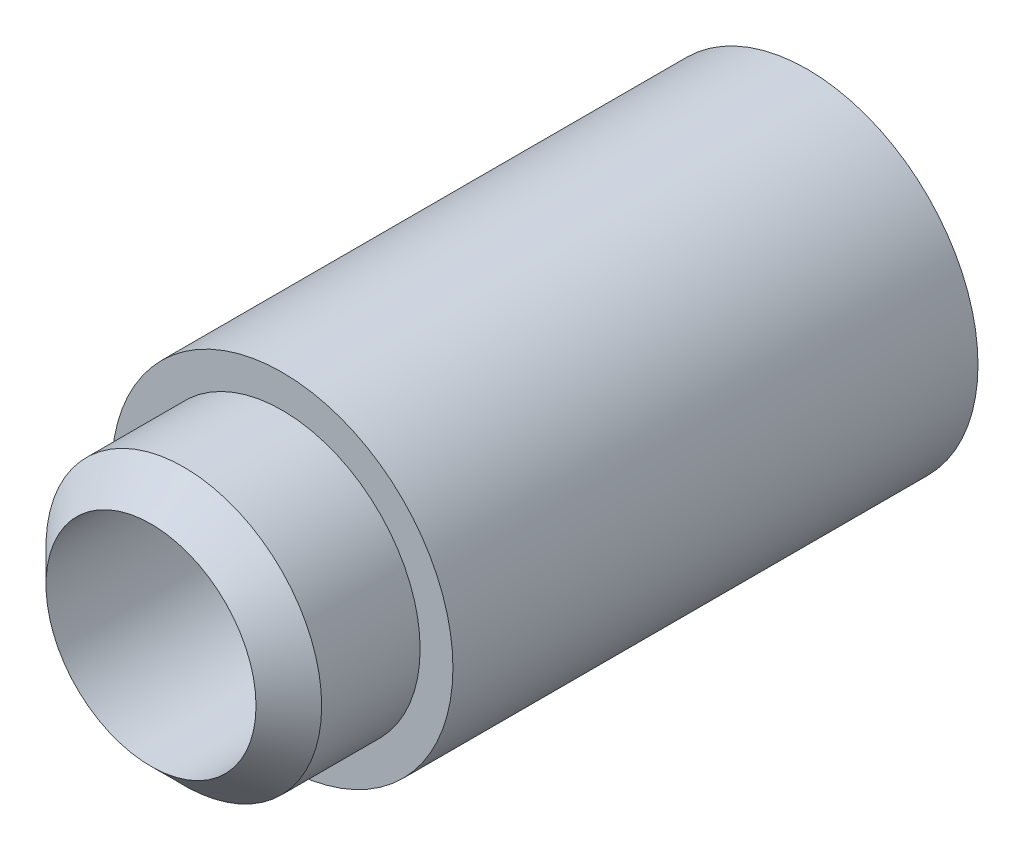
from build123d import *

# Parameters (mm, degrees)
SKETCH15_R          = 26
SKETCH15_R_2        = 21
BOSS_EXTRUDE2_DEPTH = 80
BOSS_EXTRUDE5_START = -10
SKETCH18_R          = 21
SKETCH18_R_2        = 16
BOSS_EXTRUDE5_DEPTH = 30
CHAMFER1_SIZE       = 5


with BuildPart() as part:
    # Sketch15 → Boss-Extrude2 (new body)
    with BuildSketch(Plane.XY):
        Circle(SKETCH15_R)
        Circle(SKETCH15_R_2, mode=Mode.SUBTRACT)
    extrude(amount=BOSS_EXTRUDE2_DEPTH)

    # Sketch18 → Boss-Extrude5 (add)
    with BuildSketch(Plane.XY.offset(80).offset(BOSS_EXTRUDE5_START)):
        Circle(SKETCH18_R)
        Circle(SKETCH18_R_2, mode=Mode.SUBTRACT)
    extrude(amount=BOSS_EXTRUDE5_DEPTH)

    # Chamfer1
    chamfer1_edges = [part.edges().sort_by_distance(p)[0] for p in [
        (-21, 0, 100),
    ]]
    chamfer(chamfer1_edges, length=CHAMFER1_SIZE - 0.0001)  # a hair under: the kernel refuses the full size


solid = part.part
